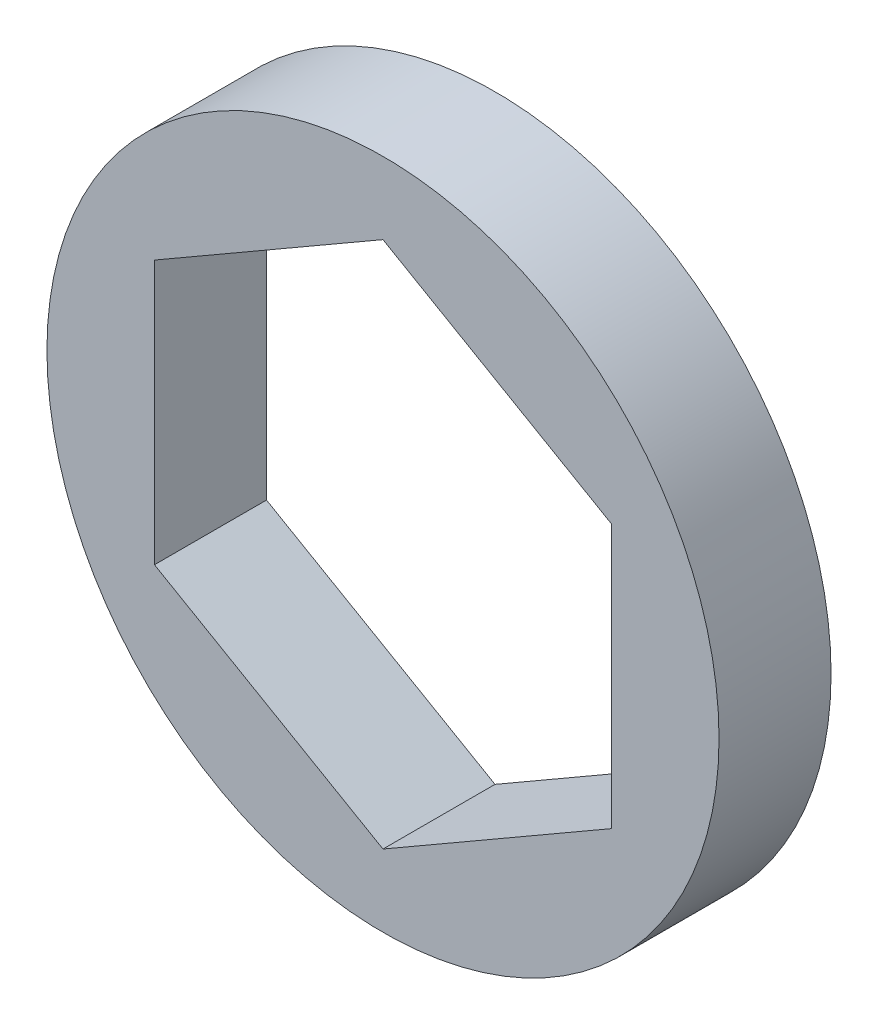
from build123d import *

# Parameters (mm, degrees)
SKETCH1_R           = 9.525
BOSS_EXTRUDE1_DEPTH = 1.5875


with BuildPart() as part:
    # Sketch1 → Boss-Extrude1 (new, symmetric)
    with BuildSketch(Plane.XY):
        Circle(SKETCH1_R)
        Polygon((0, 7.478995387), (-6.477, 3.739497694), (-6.477, -3.739497694), (0, -7.478995387), (6.477, -3.739497694), (6.477, 3.739497694), align=None, mode=Mode.SUBTRACT)
    extrude(amount=BOSS_EXTRUDE1_DEPTH, both=True)


solid = part.part
